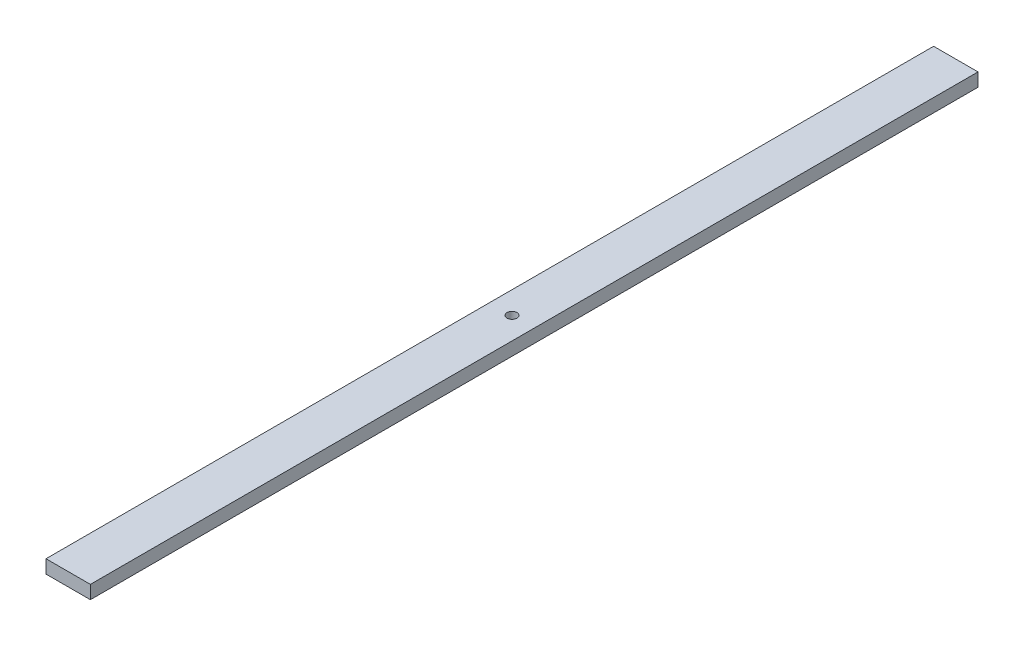
from build123d import *

# Parameters (mm, degrees)
ESQUISSE1_W             = 90
ESQUISSE1_H             = 27
BOSS_EXTRU_1_DEPTH      = 1800
ESQUISSE2_R             = 10
ENL_V_MAT_EXTRU_1_DEPTH = 1803.450831507


with BuildPart() as part:
    # Esquisse1 → Boss.-Extru.1 (new body)
    with BuildSketch(Plane.XY):
        with Locations((45, 13.5)):
            Rectangle(ESQUISSE1_W, ESQUISSE1_H)
    extrude(amount=BOSS_EXTRU_1_DEPTH)

    # Esquisse2 → Enlèv. mat.-Extru.1 (cut, through all)
    with BuildSketch(Plane.XZ):
        with Locations((45, 900)):
            Circle(ESQUISSE2_R)
    extrude(amount=-ENL_V_MAT_EXTRU_1_DEPTH, mode=Mode.SUBTRACT)


solid = part.part
